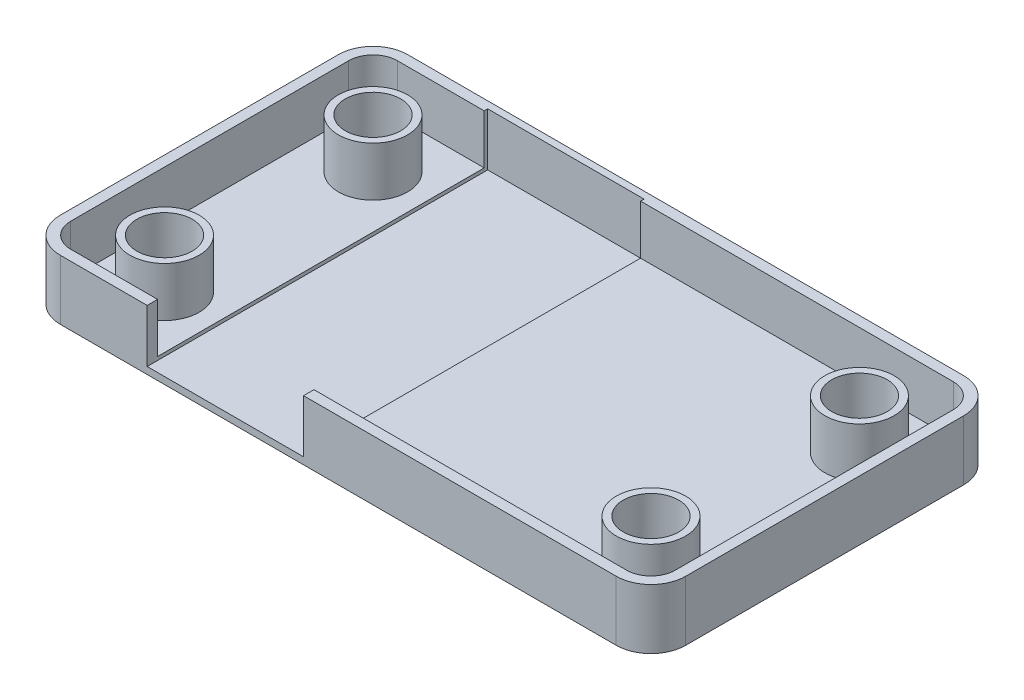
from build123d import *

# Parameters (mm, degrees)
BOSS_EXTRUDE1_DEPTH = 20
SHELL1_T            = -3
SKETCH3_R           = 9.972851257
SKETCH3_R_2         = 7.972851257
BOSS_EXTRUDE2_DEPTH = 18
SKETCH4_W           = 45
SKETCH4_H           = 16
CUT_EXTRUDE2_DEPTH  = 98
SKETCH5_W           = 196.734925073
SKETCH5_H           = 9.584521991
CUT_EXTRUDE3_DEPTH  = 116


with BuildPart() as part:
    # Sketch1 → Boss-Extrude1 (new body)
    with BuildSketch(Plane(origin=(0, 0, 0), x_dir=(1, 0, 0), z_dir=(0, 1, 0))):
        with BuildLine():
            Line((-80, -50), (80, -50))
            ThreePointArc((80, -50), (87.071067812, -47.071067812), (90, -40))
            Line((90, -40), (90, 40))
            ThreePointArc((90, 40), (87.071067812, 47.071067812), (80, 50))
            Line((80, 50), (-80, 50))
            ThreePointArc((-80, 50), (-87.071067812, 47.071067812), (-90, 40))
            Line((-90, 40), (-90, -40))
            ThreePointArc((-90, -40), (-87.071067812, -47.071067812), (-80, -50))
        make_face()
    extrude(amount=BOSS_EXTRUDE1_DEPTH)

    # Shell1
    shell1_openings = [part.faces().sort_by_distance(p)[0] for p in [
        (0, 20, 0),
    ]]
    offset(amount=SHELL1_T, openings=shell1_openings, kind=Kind.INTERSECTION)

    # Sketch3 → Boss-Extrude2 (add)
    # profile 1 of 4: a face of its own
    with BuildSketch(Plane(origin=(0, 3, 0), x_dir=(1, 0, 0), z_dir=(0, 1, 0))):
        with Locations((-70, 30)):
            Circle(SKETCH3_R)
        with Locations((-70, 30)):
            Circle(SKETCH3_R_2, mode=Mode.SUBTRACT)
    # profile 2 of 4: a face of its own
    with BuildSketch(Plane(origin=(0, 3, 0), x_dir=(1, 0, 0), z_dir=(0, 1, 0))):
        with Locations((70, 30)):
            Circle(SKETCH3_R)
        with Locations((70, 30)):
            Circle(SKETCH3_R_2, mode=Mode.SUBTRACT)
    # profile 3 of 4: a face of its own
    with BuildSketch(Plane(origin=(0, 3, 0), x_dir=(1, 0, 0), z_dir=(0, 1, 0))):
        with Locations((70, -30)):
            Circle(SKETCH3_R)
        with Locations((70, -30)):
            Circle(SKETCH3_R_2, mode=Mode.SUBTRACT)
    # profile 4 of 4: a face of its own
    with BuildSketch(Plane(origin=(0, 3, 0), x_dir=(1, 0, 0), z_dir=(0, 1, 0))):
        with Locations((-70, -30)):
            Circle(SKETCH3_R)
        with Locations((-70, -30)):
            Circle(SKETCH3_R_2, mode=Mode.SUBTRACT)
    extrude(amount=BOSS_EXTRUDE2_DEPTH)

    # Sketch4 → Cut-Extrude2 (cut)
    with BuildSketch(Plane.XY.offset(50)):
        with Locations((-32.5, 10)):
            Rectangle(SKETCH4_W, SKETCH4_H)
    extrude(amount=-CUT_EXTRUDE2_DEPTH, mode=Mode.SUBTRACT)

    # Sketch5 → Cut-Extrude3 (cut)
    with BuildSketch(Plane.XY.offset(50)):
        with Locations((5.497562081, 22.020144216)):
            Rectangle(SKETCH5_W, SKETCH5_H)
    extrude(amount=-CUT_EXTRUDE3_DEPTH, mode=Mode.SUBTRACT)


solid = part.part
